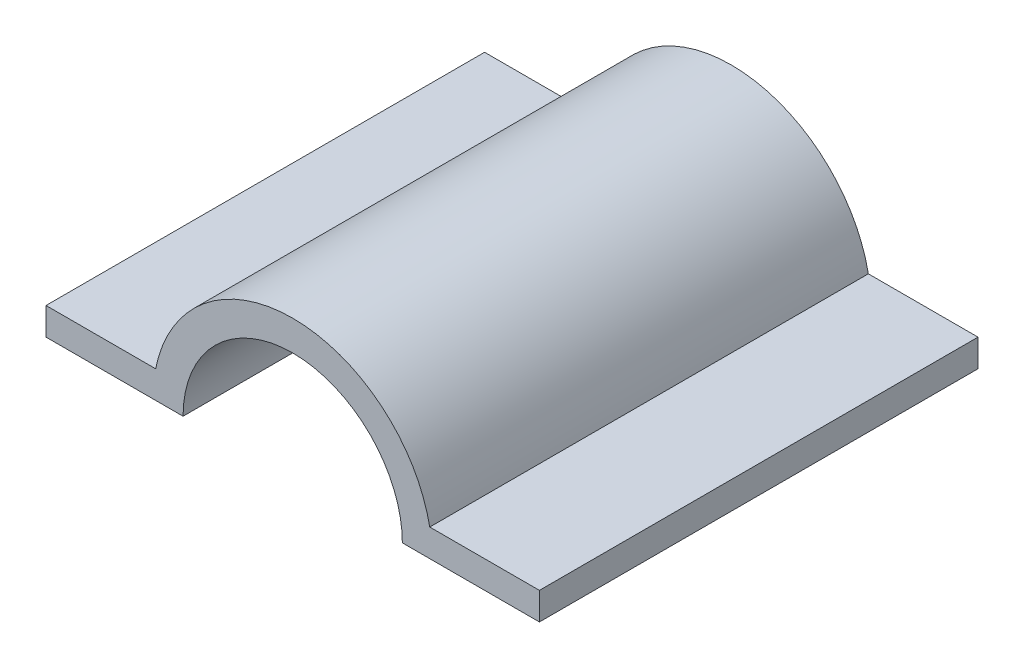
from build123d import *

# Parameters (mm, degrees)
BOSS_EXTRUDE2_DEPTH = 101.6
CUT_SWEEP2_START    = -8.197626231
CUT_SWEEP2_DEPTH    = 16.395252462


# Read off the part's stored shape, not the designer's step: Cut-Sweep2
with BuildPart() as part:
    # Sketch1 → Boss-Extrude2 (new, symmetric)
    with BuildSketch(Plane.XY):
        with BuildLine():
            Line((-50.8, 0), (-114.3, 0))
            Line((-114.3, 0), (-114.3, 12.7))
            Line((-114.3, 12.7), (-63.5, 12.7))
            ThreePointArc((-63.5, 12.7), (0, 64.757547823), (63.5, 12.7))
            Line((63.5, 12.7), (114.3, 12.7))
            Line((114.3, 12.7), (114.3, 0))
            Line((114.3, 0), (50.8, 0))
            ThreePointArc((50.8, 0), (0, 50.8), (-50.8, 0))
        make_face()
    extrude(amount=BOSS_EXTRUDE2_DEPTH, both=True)

    # Cut-Sweep2 outline → Cut-Sweep2 (cut)
    with BuildSketch(Plane.XY.offset(CUT_SWEEP2_START)):
        with BuildLine():
            Line((50.8, 0), (55.482597318, 0))
            add(Edge.make_bspline(
                [(55.482597318, 0), (55.479494195, 2.91415368), (55.255178285, 5.917770975), (54.175303072, 12.490458413), (53.25997788, 15.990881145), (50.641228247, 22.973888147), (48.970431753, 26.367184551), (44.847073202, 32.894857639), (42.443468127, 35.946208717), (37.009145884, 41.519887141), (34.016276899, 44.003484644), (27.57622226, 48.300783556), (24.203765584, 50.065786815), (13.800838479, 54.25746412), (6.656772523, 55.483587394), (-6.656785579, 55.483587394), (-13.800859436, 54.257459266), (-24.203789489, 50.065775387), (-27.576245764, 48.3007701), (-34.016297572, 44.003468622), (-37.009164361, 41.519870489), (-42.443481596, 35.946192603), (-44.847084096, 32.894842463), (-48.970437832, 26.367172857), (-50.64123252, 22.973878319), (-53.259979362, 15.990875624), (-54.175303836, 12.490454657), (-55.255178301, 5.917770093), (-55.47949419, 2.914153473), (-55.482597317, 0)],
                knots=[0.007470969, 0.007470969, 0.007470969, 0.007470969, 0.062499939, 0.062499939, 0.124999877, 0.124999877, 0.187499816, 0.187499816, 0.249999755, 0.249999755, 0.312499694, 0.312499694, 0.374999632, 0.374999632, 0.49999951, 0.49999951, 0.624999632, 0.624999632, 0.687499694, 0.687499694, 0.749999755, 0.749999755, 0.812499816, 0.812499816, 0.874999877, 0.874999877, 0.937499939, 0.937499939, 0.992529016, 0.992529016, 0.992529016, 0.992529016], degree=3))
            Line((-55.482597317, 0), (-50.8, 0))
            ThreePointArc((-50.8, 0), (0, 50.8), (50.8, 0))
        make_face()
    extrude(amount=CUT_SWEEP2_DEPTH, mode=Mode.SUBTRACT)


solid = part.part
